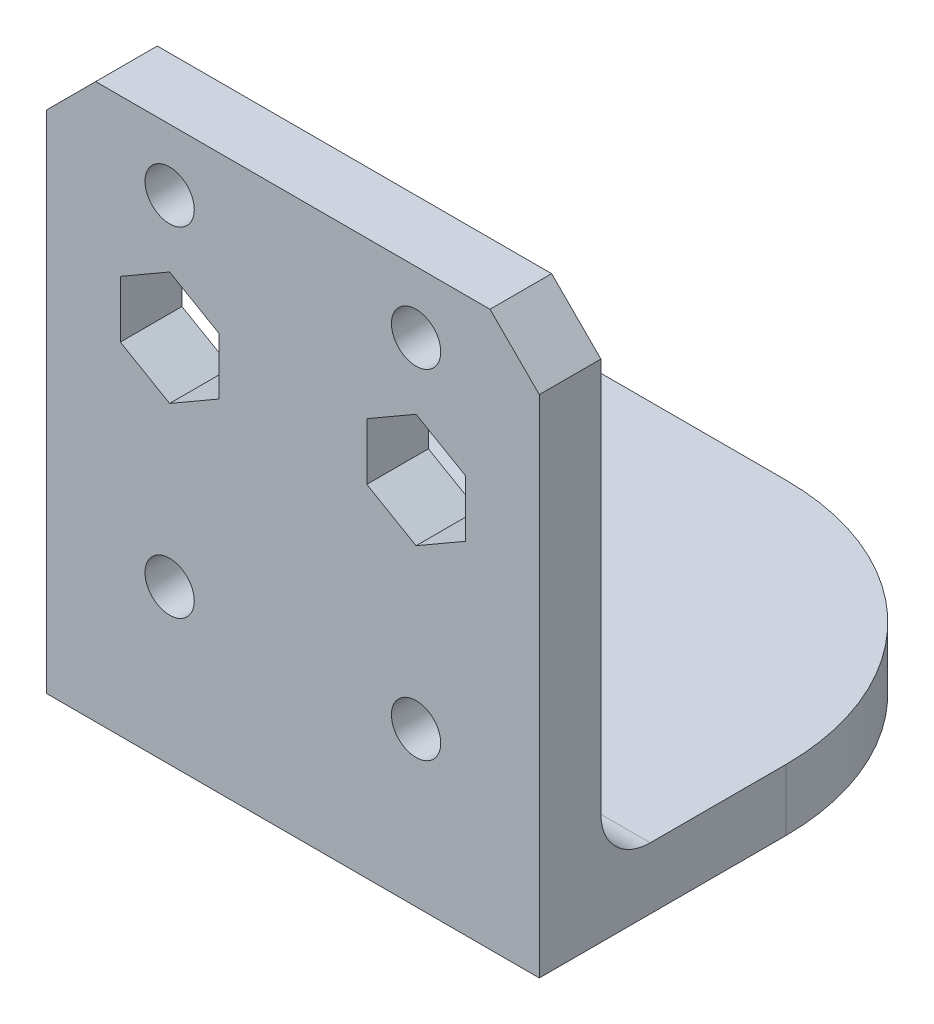
from build123d import *

# Parameters (mm, degrees)
BOSS_EXTRUDE1_DEPTH = 50.8
SKETCH2_R           = 2.54
CUT_EXTRUDE1_DEPTH  = 92.800885072
SKETCH3_R           = 1.0922
CUT_EXTRUDE2_DEPTH  = 92.800885072
FILLET1_R           = 5.08
CHAMFER1_SIZE       = 5.08
FILLET2_R           = 25.4


with BuildPart() as part:
    # Sketch1 → Boss-Extrude1 (new body)
    with BuildSketch(Plane(origin=(0, 0, 0), x_dir=(0, 0, -1), z_dir=(1, 0, 0))):
        Polygon((0, 0), (0, 57.15), (6.35, 57.15), (6.35, 6.35), (50.8, 6.35), (50.8, 0), align=None)
    extrude(amount=BOSS_EXTRUDE1_DEPTH)

    # Sketch2 → Cut-Extrude1 (cut, through all)
    with BuildSketch(Plane.XY):
        with Locations((12.7, 15.875)):
            Circle(SKETCH2_R)
        with Locations((12.7, 50.8)):
            Circle(SKETCH2_R)
        with Locations((38.1, 15.875)):
            Circle(SKETCH2_R)
        with Locations((38.1, 50.8)):
            Circle(SKETCH2_R)
        Polygon((33.02, 41.032939367), (38.1, 43.965878735), (43.18, 41.032939367), (43.18, 35.167060633), (38.1, 32.234121265), (33.02, 35.167060633), align=None)
        Polygon((17.78, 41.032939367), (12.7, 43.965878735), (7.62, 41.032939367), (7.62, 35.167060633), (12.7, 32.234121265), (17.78, 35.167060633), align=None)
    extrude(amount=-CUT_EXTRUDE1_DEPTH, mode=Mode.SUBTRACT)

    # Sketch3 → Cut-Extrude2 (cut, through all)
    with BuildSketch(Plane.XZ):
        with Locations((15.494, -15.875)):
            Circle(SKETCH3_R)
        with Locations((5.08, -38.0746)):
            Circle(SKETCH3_R)
    extrude(amount=-CUT_EXTRUDE2_DEPTH, mode=Mode.SUBTRACT)

    # Fillet1
    fillet1_edges = [part.edges().sort_by_distance(p)[0] for p in [
        (25.4, 6.35, -6.35),
    ]]
    fillet(fillet1_edges, radius=FILLET1_R)

    # Chamfer1
    chamfer1_edges = [part.edges().sort_by_distance(p)[0] for p in [
        (50.8, 57.15, -3.175),
        (0, 57.15, -3.175),
        (0, 3.175, -50.8),
    ]]
    chamfer(chamfer1_edges, length=CHAMFER1_SIZE)

    # Fillet2
    fillet2_edges = [part.edges().sort_by_distance(p)[0] for p in [
        (50.8, 3.175, -50.8),
    ]]
    fillet(fillet2_edges, radius=FILLET2_R)


solid = part.part
